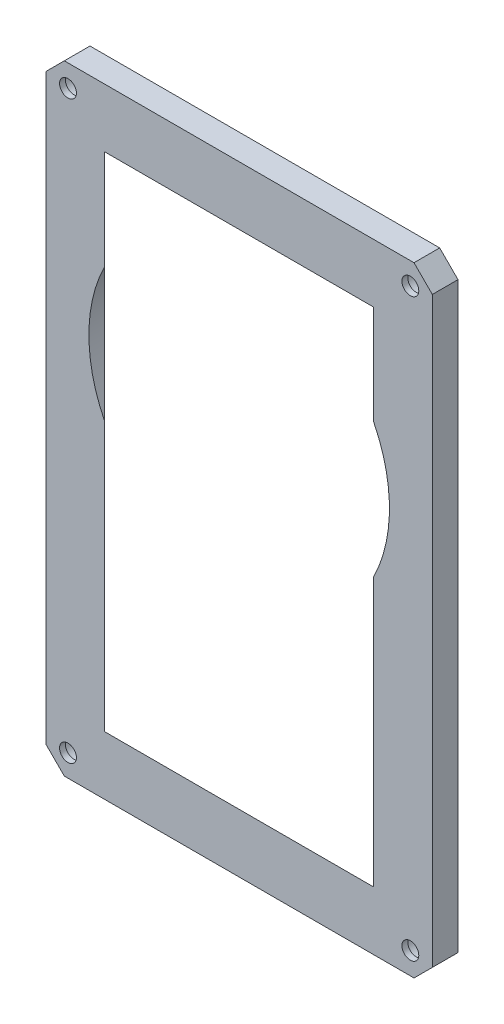
from build123d import *

# Parameters (mm, degrees)
ESQUISSE1_W             = 105.4
ESQUISSE1_H             = 169
ESQUISSE1_W_2           = 69.4
ESQUISSE1_H_2           = 133
BOSS_EXTRU_1_DEPTH      = 7
CHANFREIN4_SIZE         = 5
CHANFREIN3_SIZE         = 9
ENL_V_MAT_EXTRU_1_REACH = 101.833
ESQUISSE2_R             = 2.3
ENL_V_START             = -5.4
ESQUISSE5_R             = 3.7
ESQUISSE5_R_2           = 2.3
ENL_V_MAT_EXTRU_4_DEPTH = 5.4
ENL_V_START_2           = -4.3
ESQUISSE4_R             = 41
ENL_V_MAT_EXTRU_3_DEPTH = 4.3


with BuildPart() as part:
    # Esquisse1 → Boss.-Extru.1 (new body)
    with BuildSketch(Plane.XY):
        Rectangle(ESQUISSE1_W, ESQUISSE1_H)
        Rectangle(ESQUISSE1_W_2, ESQUISSE1_H_2, mode=Mode.SUBTRACT)
    extrude(amount=-BOSS_EXTRU_1_DEPTH)

    # Chanfrein4
    chanfrein4_edges = [part.edges().sort_by_distance(p)[0] for p in [
        (-52.7, 84.5, -3.5),
        (52.7, 84.5, -3.5),
        (52.7, -84.5, -3.5),
        (-52.7, -84.5, -3.5),
    ]]
    chamfer(chanfrein4_edges, length=CHANFREIN4_SIZE)

    # Chanfrein3
    # the kernel refuses this chamfer: 9 mm, written as the material it takes off along each edge
    with BuildSketch(Plane(origin=(-34.7, -66.5, -7), x_dir=(-0.9996219169112966, 0, -0.0274958766105864), z_dir=(0, 1, 0)), Plane(origin=(34.7, 66.5, -7), x_dir=(0.9996219169112966, 0, -0.0274958766105864), z_dir=(0, -1, 0))) as chanfrein3_piece_1:
        Polygon((CHANFREIN3_SIZE * 0.999621916911, CHANFREIN3_SIZE * 0.0274958766106), (-CHANFREIN3_SIZE * 0.0274958766106, CHANFREIN3_SIZE * 0.999621916911), (0, 0), align=None)
    extrude(amount=133, mode=Mode.SUBTRACT)
    with BuildSketch(Plane(origin=(-34.7, 66.5, -7), x_dir=(0, 0.9996219169112966, -0.02749587661058638), z_dir=(1, 0, 0)), Plane(origin=(34.7, -66.5, -7), x_dir=(0, -0.9996219169112966, -0.02749587661058638), z_dir=(-1, 0, 0))) as chanfrein3_piece_2:
        Polygon((CHANFREIN3_SIZE * 0.999621916911, CHANFREIN3_SIZE * 0.0274958766106), (-CHANFREIN3_SIZE * 0.0274958766106, CHANFREIN3_SIZE * 0.999621916911), (0, 0), align=None)
    extrude(amount=69.4, mode=Mode.SUBTRACT)
    with BuildSketch(Plane(origin=(-34.7, -89.645146892, -7), x_dir=(-0.9996219169112966, 0, -0.0274958766105864), z_dir=(0, 1, 0))) as chanfrein3_piece_3a_section:
        Polygon((CHANFREIN3_SIZE * 0.999621916911, CHANFREIN3_SIZE * 0.0274958766106), (-CHANFREIN3_SIZE * 0.0274958766106, CHANFREIN3_SIZE * 0.999621916911), (0, 0), align=None)
    chanfrein3_piece_3a = extrude(amount=156.145146892, mode=Mode.PRIVATE)
    chanfrein3_piece_3a = split(chanfrein3_piece_3a, bisect_by=Plane(origin=(-37.668142641, -66.5, -4.031857359), z_dir=(0, -1, 0)), keep=Keep.TOP, mode=Mode.PRIVATE)
    with BuildSketch(Plane(origin=(34.7, -66.5, -7), x_dir=(0, -0.9996219169112966, -0.02749587661058638), z_dir=(-1, 0, 0))) as chanfrein3_piece_3b_section:
        Polygon((CHANFREIN3_SIZE * 0.999621916911, CHANFREIN3_SIZE * 0.0274958766106), (-CHANFREIN3_SIZE * 0.0274958766106, CHANFREIN3_SIZE * 0.999621916911), (0, 0), align=None)
    chanfrein3_piece_3b = extrude(amount=92.545146892, mode=Mode.PRIVATE)
    chanfrein3_piece_3b = split(chanfrein3_piece_3b, bisect_by=Plane(origin=(-34.7, -69.468142641, -4.031857359), z_dir=(-1, 0, 0)), keep=Keep.TOP, mode=Mode.PRIVATE)
    chanfrein3_piece_3 = chanfrein3_piece_3a & chanfrein3_piece_3b
    add(chanfrein3_piece_3, mode=Mode.SUBTRACT)
    with BuildSketch(Plane(origin=(-34.7, -66.5, -7), x_dir=(-0.9996219169112966, 0, -0.0274958766105864), z_dir=(0, 1, 0))) as chanfrein3_piece_4a_section:
        Polygon((CHANFREIN3_SIZE * 0.999621916911, CHANFREIN3_SIZE * 0.0274958766106), (-CHANFREIN3_SIZE * 0.0274958766106, CHANFREIN3_SIZE * 0.999621916911), (0, 0), align=None)
    chanfrein3_piece_4a = extrude(amount=156.145146892, mode=Mode.PRIVATE)
    chanfrein3_piece_4a = split(chanfrein3_piece_4a, bisect_by=Plane(origin=(-37.668142641, 66.5, -4.031857359), z_dir=(0, 1, 0)), keep=Keep.TOP, mode=Mode.PRIVATE)
    with BuildSketch(Plane(origin=(-57.845146892, 66.5, -7), x_dir=(0, 0.9996219169112966, -0.02749587661058638), z_dir=(1, 0, 0))) as chanfrein3_piece_4b_section:
        Polygon((CHANFREIN3_SIZE * 0.999621916911, CHANFREIN3_SIZE * 0.0274958766106), (-CHANFREIN3_SIZE * 0.0274958766106, CHANFREIN3_SIZE * 0.999621916911), (0, 0), align=None)
    chanfrein3_piece_4b = extrude(amount=92.545146892, mode=Mode.PRIVATE)
    chanfrein3_piece_4b = split(chanfrein3_piece_4b, bisect_by=Plane(origin=(-34.7, 69.468142641, -4.031857359), z_dir=(-1, 0, 0)), keep=Keep.TOP, mode=Mode.PRIVATE)
    chanfrein3_piece_4 = chanfrein3_piece_4a & chanfrein3_piece_4b
    add(chanfrein3_piece_4, mode=Mode.SUBTRACT)
    with BuildSketch(Plane(origin=(34.7, 89.645146892, -7), x_dir=(0.9996219169112966, 0, -0.0274958766105864), z_dir=(0, -1, 0))) as chanfrein3_piece_5a_section:
        Polygon((CHANFREIN3_SIZE * 0.999621916911, CHANFREIN3_SIZE * 0.0274958766106), (-CHANFREIN3_SIZE * 0.0274958766106, CHANFREIN3_SIZE * 0.999621916911), (0, 0), align=None)
    chanfrein3_piece_5a = extrude(amount=156.145146892, mode=Mode.PRIVATE)
    chanfrein3_piece_5a = split(chanfrein3_piece_5a, bisect_by=Plane(origin=(37.668142641, 66.5, -4.031857359), z_dir=(0, 1, 0)), keep=Keep.TOP, mode=Mode.PRIVATE)
    with BuildSketch(Plane(origin=(-34.7, 66.5, -7), x_dir=(0, 0.9996219169112966, -0.02749587661058638), z_dir=(1, 0, 0))) as chanfrein3_piece_5b_section:
        Polygon((CHANFREIN3_SIZE * 0.999621916911, CHANFREIN3_SIZE * 0.0274958766106), (-CHANFREIN3_SIZE * 0.0274958766106, CHANFREIN3_SIZE * 0.999621916911), (0, 0), align=None)
    chanfrein3_piece_5b = extrude(amount=92.545146892, mode=Mode.PRIVATE)
    chanfrein3_piece_5b = split(chanfrein3_piece_5b, bisect_by=Plane(origin=(34.7, 69.468142641, -4.031857359), z_dir=(1, 0, 0)), keep=Keep.TOP, mode=Mode.PRIVATE)
    chanfrein3_piece_5 = chanfrein3_piece_5a & chanfrein3_piece_5b
    add(chanfrein3_piece_5, mode=Mode.SUBTRACT)
    with BuildSketch(Plane(origin=(57.845146892, -66.5, -7), x_dir=(0, -0.9996219169112966, -0.02749587661058638), z_dir=(-1, 0, 0))) as chanfrein3_piece_6a_section:
        Polygon((CHANFREIN3_SIZE * 0.999621916911, CHANFREIN3_SIZE * 0.0274958766106), (-CHANFREIN3_SIZE * 0.0274958766106, CHANFREIN3_SIZE * 0.999621916911), (0, 0), align=None)
    chanfrein3_piece_6a = extrude(amount=92.545146892, mode=Mode.PRIVATE)
    chanfrein3_piece_6a = split(chanfrein3_piece_6a, bisect_by=Plane(origin=(34.7, -69.468142641, -4.031857359), z_dir=(1, 0, 0)), keep=Keep.TOP, mode=Mode.PRIVATE)
    with BuildSketch(Plane(origin=(34.7, 66.5, -7), x_dir=(0.9996219169112966, 0, -0.0274958766105864), z_dir=(0, -1, 0))) as chanfrein3_piece_6b_section:
        Polygon((CHANFREIN3_SIZE * 0.999621916911, CHANFREIN3_SIZE * 0.0274958766106), (-CHANFREIN3_SIZE * 0.0274958766106, CHANFREIN3_SIZE * 0.999621916911), (0, 0), align=None)
    chanfrein3_piece_6b = extrude(amount=156.145146892, mode=Mode.PRIVATE)
    chanfrein3_piece_6b = split(chanfrein3_piece_6b, bisect_by=Plane(origin=(37.668142641, -66.5, -4.031857359), z_dir=(0, -1, 0)), keep=Keep.TOP, mode=Mode.PRIVATE)
    chanfrein3_piece_6 = chanfrein3_piece_6a & chanfrein3_piece_6b
    add(chanfrein3_piece_6, mode=Mode.SUBTRACT)

    # Esquisse2 → Enlèv. mat.-Extru.1 (cut, up to next)
    with BuildSketch(Plane.XY, mode=Mode.PRIVATE) as enl_v_mat_extru_1_sk1:
        with Locations((-46.7, 78.5)):
            Circle(ESQUISSE2_R)
    enl_v_mat_extru_1_tool1 = extrude(enl_v_mat_extru_1_sk1.sketch, amount=-ENL_V_MAT_EXTRU_1_REACH, mode=Mode.PRIVATE) & part.part
    # Esquisse2 → Enlèv. mat.-Extru.1 (cut, up to next)
    with BuildSketch(Plane.XY, mode=Mode.PRIVATE) as enl_v_mat_extru_1_sk2:
        with Locations((46.7, 78.5)):
            Circle(ESQUISSE2_R)
    enl_v_mat_extru_1_tool2 = extrude(enl_v_mat_extru_1_sk2.sketch, amount=-ENL_V_MAT_EXTRU_1_REACH, mode=Mode.PRIVATE) & part.part
    # Esquisse2 → Enlèv. mat.-Extru.1 (cut, up to next)
    with BuildSketch(Plane.XY, mode=Mode.PRIVATE) as enl_v_mat_extru_1_sk3:
        with Locations((-46.7, -78.5)):
            Circle(ESQUISSE2_R)
    enl_v_mat_extru_1_tool3 = extrude(enl_v_mat_extru_1_sk3.sketch, amount=-ENL_V_MAT_EXTRU_1_REACH, mode=Mode.PRIVATE) & part.part
    # Esquisse2 → Enlèv. mat.-Extru.1 (cut, up to next)
    with BuildSketch(Plane.XY, mode=Mode.PRIVATE) as enl_v_mat_extru_1_sk4:
        with Locations((46.7, -78.5)):
            Circle(ESQUISSE2_R)
    enl_v_mat_extru_1_tool4 = extrude(enl_v_mat_extru_1_sk4.sketch, amount=-ENL_V_MAT_EXTRU_1_REACH, mode=Mode.PRIVATE) & part.part
    add(enl_v_mat_extru_1_tool1.solids().sort_by_distance((-46.7, 78.5, 0))[0], mode=Mode.SUBTRACT)
    add(enl_v_mat_extru_1_tool2.solids().sort_by_distance((46.7, 78.5, 0))[0], mode=Mode.SUBTRACT)
    add(enl_v_mat_extru_1_tool3.solids().sort_by_distance((-46.7, -78.5, 0))[0], mode=Mode.SUBTRACT)
    add(enl_v_mat_extru_1_tool4.solids().sort_by_distance((46.7, -78.5, 0))[0], mode=Mode.SUBTRACT)

    # Esquisse5 → Enlèv. mat.-Extru.4 (cut)
    # profile 1 of 4: a face of its own
    with BuildSketch(Plane(origin=(0, 0, -7), x_dir=(-1, 0, 0), z_dir=(0, 0, -1)).offset(ENL_V_START)):
        with Locations((-46.7, 78.5)):
            Circle(ESQUISSE5_R)
        with Locations(Location((-46.7, 78.5, 0), (0, 0, 180))):
            Circle(ESQUISSE5_R_2, mode=Mode.SUBTRACT)
    # profile 2 of 4: a face of its own
    with BuildSketch(Plane(origin=(0, 0, -7), x_dir=(-1, 0, 0), z_dir=(0, 0, -1)).offset(ENL_V_START)):
        with Locations((46.7, 78.5)):
            Circle(ESQUISSE5_R)
        with Locations(Location((46.7, 78.5, 0), (0, 0, 180))):
            Circle(ESQUISSE5_R_2, mode=Mode.SUBTRACT)
    # profile 3 of 4: a face of its own
    with BuildSketch(Plane(origin=(0, 0, -7), x_dir=(-1, 0, 0), z_dir=(0, 0, -1)).offset(ENL_V_START)):
        with Locations((46.7, -78.5)):
            Circle(ESQUISSE5_R)
        with Locations(Location((46.7, -78.5, 0), (0, 0, 180))):
            Circle(ESQUISSE5_R_2, mode=Mode.SUBTRACT)
    # profile 4 of 4: a face of its own
    with BuildSketch(Plane(origin=(0, 0, -7), x_dir=(-1, 0, 0), z_dir=(0, 0, -1)).offset(ENL_V_START)):
        with Locations((-46.7, -78.5)):
            Circle(ESQUISSE5_R)
        with Locations(Location((-46.7, -78.5, 0), (0, 0, 180))):
            Circle(ESQUISSE5_R_2, mode=Mode.SUBTRACT)
    extrude(amount=ENL_V_MAT_EXTRU_4_DEPTH, mode=Mode.SUBTRACT)

    # Esquisse4 → Enlèv. mat.-Extru.3 (cut)
    with BuildSketch(Plane.XY.offset(ENL_V_START_2)):
        with Locations((0, 23.1)):
            Circle(ESQUISSE4_R)
    extrude(amount=ENL_V_MAT_EXTRU_3_DEPTH, mode=Mode.SUBTRACT)


solid = part.part
